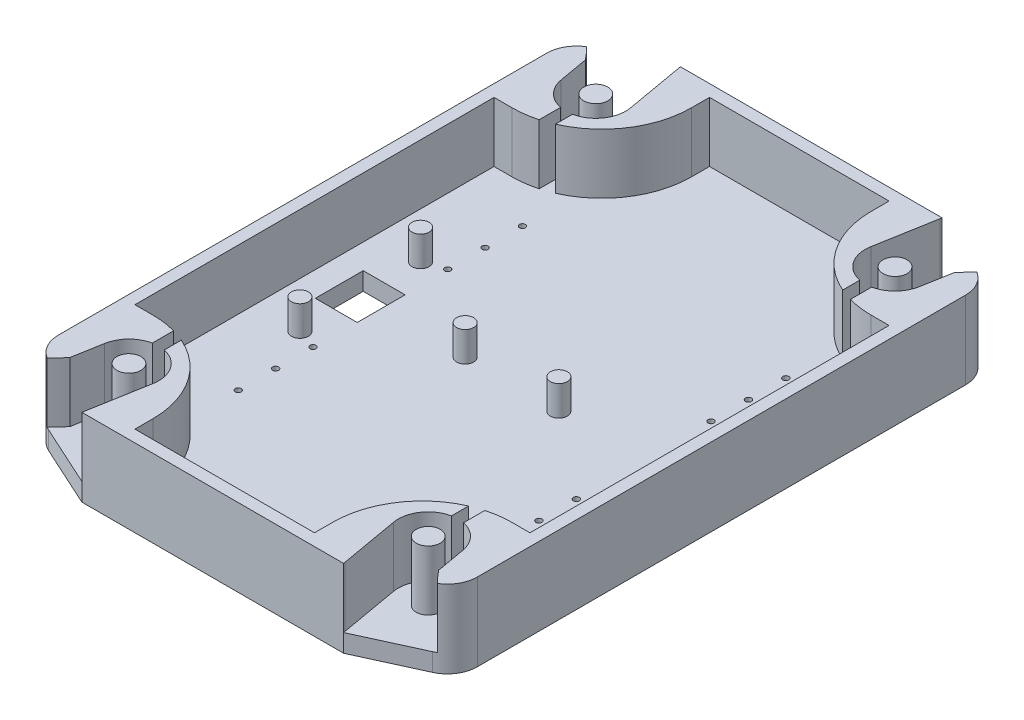
from build123d import *

# Parameters (mm, degrees)
CROQUIS2_W                = 70
CROQUIS2_H                = 3
SALIENTE_EXTRUIR1_DEPTH   = 100
CROQUIS3_W                = 20
CROQUIS3_H                = 20
SALIENTE_EXTRUIR2_DEPTH   = 10
CROQUIS4_W                = 30
CROQUIS4_H                = 10
CORTAR_EXTRUIR1_DEPTH     = 10
CROQUIS6_W                = 10
CROQUIS6_H                = 25
CORTAR_EXTRUIR6_DEPTH     = 1.5
CROQUIS7_R                = 1.425
SALIENTE_EXTRUIR3_DEPTH   = 5
CROQUIS9_R                = 1.425
SALIENTE_EXTRUIR4_DEPTH   = 5
CROQUIS11_W               = 7
CROQUIS11_H               = 8
CORTAR_EXTRUIR8_DEPTH     = 5
CROQUIS12_W               = 2
CROQUIS12_H               = 60
CROQUIS12_W_2             = 30
CROQUIS12_H_2             = 2
SALIENTE_EXTRUIR5_DEPTH   = 10
CROQUIS13_R               = 2
CORTAR_EXTRUIR9_DEPTH     = 10
CORTAR_EXTRUIR10_DEPTH    = 10
REDONDEO1_R               = 15
CORTAR_EXTRUIR11_DEPTH    = 107.418983405
REDONDEO4_R               = 5
CORTAR_EXTRUIR12_DEPTH    = 1.5
CROQUIS18_R               = 1
CORTAR_EXTRUIR13_DEPTH    = 1
SIMETR_A5_COPY_1_DEPTH    = 1.5
SIMETR_A5_COPY_2_SKETCH_R = 1
SIMETR_A5_COPY_2_DEPTH    = 1
CROQUIS19_W               = 2
CROQUIS19_H               = 9.548619871
CORTAR_EXTRUIR14_DEPTH    = 10
CROQUIS24_R               = 0.5
CORTAR_EXTRUIR18_DEPTH    = 10
CROQUIS25_R               = 0.5
CORTAR_EXTRUIR19_DEPTH    = 10
CROQUIS26_R               = 0.5
CORTAR_EXTRUIR20_DEPTH    = 10


with BuildPart() as part:
    # Croquis2 → Saliente-Extruir1 (new body)
    with BuildSketch(Plane.XY):
        Rectangle(CROQUIS2_W, CROQUIS2_H)
    extrude(amount=SALIENTE_EXTRUIR1_DEPTH)

    # Croquis3 → Saliente-Extruir2 (add)
    with BuildSketch(Plane(origin=(0, 1.5, 0), x_dir=(1, 0, 0), z_dir=(0, 1, 0))):
        with Locations((-25, -10)):
            Rectangle(CROQUIS3_W, CROQUIS3_H)
        with Locations((25, -10)):
            Rectangle(CROQUIS3_W, CROQUIS3_H)
        with Locations((25, -90)):
            Rectangle(CROQUIS3_W, CROQUIS3_H)
        with Locations((-25, -90)):
            Rectangle(CROQUIS3_W, CROQUIS3_H)
    extrude(amount=SALIENTE_EXTRUIR2_DEPTH)

    # Croquis4 → Cortar-Extruir1 (cut)
    with BuildSketch(Plane(origin=(0, 1.5, 0), x_dir=(1, 0, 0), z_dir=(0, 1, 0))):
        with Locations((0, -93)):
            Rectangle(CROQUIS4_W, CROQUIS4_H)
    extrude(amount=-CORTAR_EXTRUIR1_DEPTH, mode=Mode.SUBTRACT)

    # Croquis6 → Cortar-Extruir6 (cut)
    with BuildSketch(Plane.XZ.offset(1.5)):
        with Locations((-20, 67.5)):
            Rectangle(CROQUIS6_W, CROQUIS6_H)
        with Locations((-20, 32.5)):
            Rectangle(CROQUIS6_W, CROQUIS6_H)
        with Locations((20, 32.5)):
            Rectangle(CROQUIS6_W, CROQUIS6_H)
        with Locations((20, 67.5)):
            Rectangle(CROQUIS6_W, CROQUIS6_H)
    extrude(amount=-CORTAR_EXTRUIR6_DEPTH, mode=Mode.SUBTRACT)

    # Croquis7 → Saliente-Extruir3 (add)
    with BuildSketch(Plane(origin=(0, 1.5, 0), x_dir=(1, 0, 0), z_dir=(0, 1, 0))):
        with Locations(Location((-25.358591425, -60.075, 0), (0, 0, 90))):
            Circle(CROQUIS7_R)
        with Locations(Location((-25.358591425, -39.925, 0), (0, 0, 90))):
            Circle(CROQUIS7_R)
    extrude(amount=SALIENTE_EXTRUIR3_DEPTH)

    # Croquis9 → Saliente-Extruir4 (add)
    with BuildSketch(Plane(origin=(0, 1.5, 0), x_dir=(1, 0, 0), z_dir=(0, 1, 0))):
        with Locations(Location((-7.825, -50, 0), (0, 0, 90))):
            Circle(CROQUIS9_R)
        with Locations(Location((7.825, -50, 0), (0, 0, 90))):
            Circle(CROQUIS9_R)
    extrude(amount=SALIENTE_EXTRUIR4_DEPTH)

    # Croquis11 → Cortar-Extruir8 (cut)
    with BuildSketch(Plane(origin=(0, 1.5, 0), x_dir=(1, 0, 0), z_dir=(0, 1, 0))):
        with Locations((-25.358591425, -50)):
            Rectangle(CROQUIS11_W, CROQUIS11_H)
    extrude(amount=-CORTAR_EXTRUIR8_DEPTH, mode=Mode.SUBTRACT)

    # Croquis12 → Saliente-Extruir5 (add)
    with BuildSketch(Plane(origin=(0, 1.5, 0), x_dir=(1, 0, 0), z_dir=(0, 1, 0))):
        with Locations((-34, -50)):
            Rectangle(CROQUIS12_W, CROQUIS12_H)
        with Locations((0, -99)):
            Rectangle(CROQUIS12_W_2, CROQUIS12_H_2)
        with Locations((34, -50)):
            Rectangle(CROQUIS12_W, CROQUIS12_H)
        with Locations((0, -1)):
            Rectangle(CROQUIS12_W_2, CROQUIS12_H_2)
    extrude(amount=SALIENTE_EXTRUIR5_DEPTH)

    # Croquis13 → Cortar-Extruir9 (cut)
    # profile 1 of 2: a face of its own
    with BuildSketch(Plane(origin=(0, 11.5, 0), x_dir=(1, 0, 0), z_dir=(0, 1, 0))):
        with BuildLine():
            Line((-29.924038765, -11.868240888), (-31.660520542, -2.020163358))
            ThreePointArc((-31.660520542, -2.020163358), (-27.604722665, 3.772116295), (-21.812443012, -0.283681582))
            Line((-21.812443012, -0.283681582), (-20.075961235, -10.131759112))
            ThreePointArc((-20.075961235, -10.131759112), (-24.131759112, -15.924038765), (-29.924038765, -11.868240888))
        make_face()
        with Locations(Location((-25, -11, 0), (0, 0, 270))):
            Circle(CROQUIS13_R, mode=Mode.SUBTRACT)
    # profile 2 of 2: a face of its own
    with BuildSketch(Plane(origin=(0, 11.5, 0), x_dir=(1, 0, 0), z_dir=(0, 1, 0))):
        with BuildLine():
            Line((29.924038765, -11.868240888), (31.660520542, -2.020163358))
            ThreePointArc((31.660520542, -2.020163358), (27.604722665, 3.772116295), (21.812443012, -0.283681582))
            Line((21.812443012, -0.283681582), (20.075961235, -10.131759112))
            ThreePointArc((20.075961235, -10.131759112), (24.131759112, -15.924038765), (29.924038765, -11.868240888))
        make_face()
        with Locations(Location((25, -11, 0), (0, 0, 90))):
            Circle(CROQUIS13_R, mode=Mode.SUBTRACT)
    cortar_extruir9 = extrude(amount=-CORTAR_EXTRUIR9_DEPTH, mode=Mode.SUBTRACT)

    # Simetría1: Cortar-Extruir9 across plane
    add(cortar_extruir9.mirror(Plane(origin=(0, 0, 50), x_dir=(1, 0, 0), z_dir=(0, 0, -1))), mode=Mode.SUBTRACT)

    # Croquis14 → Cortar-Extruir10 (cut)
    with BuildSketch(Plane(origin=(0, 11.5, 0), x_dir=(1, 0, 0), z_dir=(0, 1, 0))):
        with BuildLine():
            Line((-30.792279653, -6.944202123), (-30.792279653, 3.632920573))
            Line((-30.792279653, 3.632920573), (-47.516838987, 3.632920573))
            Line((-47.516838987, 3.632920573), (-47.516838987, 0))
            add(Edge.make_bspline(
                [(-30.792279653, -6.944202123), (-37.68049077, 1.574687245), (-47.516838987, 0)],
                knots=[0, 0, 0, 1, 1, 1], degree=2))
        make_face()
        with BuildLine():
            Line((30.792279653, 3.632920573), (47.516838987, 3.632920573))
            Line((47.516838987, 3.632920573), (47.516838987, 0))
            add(Edge.make_bspline(
                [(30.792279653, -6.944202123), (37.68049077, 1.574687245), (47.516838987, 0)],
                knots=[0, 0, 0, 1, 1, 1], degree=2))
            Line((30.792279653, -6.944202123), (30.792279653, 3.632920573))
        make_face()
    cortar_extruir10 = extrude(amount=-CORTAR_EXTRUIR10_DEPTH, mode=Mode.SUBTRACT)

    # Simetría2: Cortar-Extruir10 across plane
    add(cortar_extruir10.mirror(Plane(origin=(0, 0, 50), x_dir=(1, 0, 0), z_dir=(0, 0, -1))), mode=Mode.SUBTRACT)

    # Redondeo1
    # the kernel refuses this fillet: 15 mm, written as the material it takes off along each edge
    with BuildSketch(Plane(origin=(-15, -36, 80), x_dir=(-1, 0, 0), z_dir=(0, 1, 0))) as redondeo1_piece_1_section:
        with BuildLine():
            CenterArc((REDONDEO1_R, REDONDEO1_R), REDONDEO1_R, 180, 90)
            Line((0, REDONDEO1_R), (0, 0))
            Line((0, 0), (REDONDEO1_R, 0))
        make_face()
    redondeo1_piece_1 = extrude(amount=85, mode=Mode.PRIVATE)
    redondeo1_piece_1 = split(redondeo1_piece_1, bisect_by=Plane(origin=(-15.514459499, -0.75, 88), z_dir=(0, 0, 1)), keep=Keep.TOP, mode=Mode.PRIVATE)
    add(redondeo1_piece_1, mode=Mode.SUBTRACT)
    with BuildSketch(Plane(origin=(-15, 1.5, 80), x_dir=(-1, 0, 0), z_dir=(0, 1, 0)), Plane(origin=(-15, 1.5, 20), x_dir=(0, 0, -1), z_dir=(0, 1, 0)), Plane(origin=(15, 1.5, 20), x_dir=(1, 0, 0), z_dir=(0, 1, 0)), Plane(origin=(15, 1.5, 80), x_dir=(0, 0, 1), z_dir=(0, 1, 0))) as redondeo1_piece_2:
        with BuildLine():
            CenterArc((REDONDEO1_R, REDONDEO1_R), REDONDEO1_R, 180, 90)
            Line((0, REDONDEO1_R), (0, 0))
            Line((0, 0), (REDONDEO1_R, 0))
        make_face()
    extrude(amount=47.5, mode=Mode.SUBTRACT)
    with BuildSketch(Plane(origin=(15, -36, 80), x_dir=(0, 0, 1), z_dir=(0, 1, 0))) as redondeo1_piece_3_section:
        with BuildLine():
            CenterArc((REDONDEO1_R, REDONDEO1_R), REDONDEO1_R, 180, 90)
            Line((0, REDONDEO1_R), (0, 0))
            Line((0, 0), (REDONDEO1_R, 0))
        make_face()
    redondeo1_piece_3 = extrude(amount=85, mode=Mode.PRIVATE)
    redondeo1_piece_3 = split(redondeo1_piece_3, bisect_by=Plane(origin=(15.514459499, -0.75, 88), z_dir=(0, 0, 1)), keep=Keep.TOP, mode=Mode.PRIVATE)
    add(redondeo1_piece_3, mode=Mode.SUBTRACT)

    # Croquis16 → Cortar-Extruir11 (cut, symmetric)
    with BuildSketch(Plane(origin=(0, 1.5, 0), x_dir=(1, 0, 0), z_dir=(0, 1, 0))):
        Polygon((-21.870983383, -100), (-35.000000004, -94), (-35, -100), align=None)
        Polygon((35.000000004, -94), (35, -100), (21.870983383, -100), align=None)
    cortar_extruir11 = extrude(amount=CORTAR_EXTRUIR11_DEPTH, both=True, mode=Mode.SUBTRACT)

    # Simetría3: Cortar-Extruir11 across plane
    add(cortar_extruir11.mirror(Plane(origin=(0, 0, 50), x_dir=(1, 0, 0), z_dir=(0, 0, -1))), mode=Mode.SUBTRACT)

    # Redondeo4
    redondeo4_edges = [part.edges().sort_by_distance(p)[0] for p in [
        (35.000000004, 5, 94),
        (-35.000000004, 5, 94),
        (35.000000004, 5, 6),
        (-35.000000004, 5, 6),
    ]]
    fillet(redondeo4_edges, radius=REDONDEO4_R)

    # Croquis17 → Cortar-Extruir12 (cut)
    with BuildSketch(Plane.XZ.offset(1.5)):
        with BuildLine():
            Line((-32.317047737, 87.192172163), (-24.609624551, 93.563641996))
            ThreePointArc((-24.609624551, 93.563641996), (-21.089901296, 93.229653658), (-21.423889634, 89.709930404))
            Line((-21.423889634, 89.709930404), (-29.13131282, 83.33846057))
            ThreePointArc((-29.13131282, 83.33846057), (-32.651036075, 83.672448908), (-32.317047737, 87.192172163))
        make_face()
    cortar_extruir12 = extrude(amount=-CORTAR_EXTRUIR12_DEPTH, mode=Mode.SUBTRACT)

    # Croquis18 → Cortar-Extruir13 (cut)
    with BuildSketch(Plane.XZ):
        with Locations(Location((-30.724180278, 85.265316367, 0), (0, 0, 270))):
            Circle(CROQUIS18_R)
        with Locations(Location((-23.016757093, 91.6367862, 0), (0, 0, 270))):
            Circle(CROQUIS18_R)
    cortar_extruir13 = extrude(amount=-CORTAR_EXTRUIR13_DEPTH, mode=Mode.SUBTRACT)

    # Simetría4: Cortar-Extruir12, Cortar-Extruir13 across plane
    add(cortar_extruir12.mirror(Plane(origin=(0, 0, 0), x_dir=(0, 0, 1), z_dir=(1, 0, 0))), mode=Mode.SUBTRACT)
    add(cortar_extruir13.mirror(Plane(origin=(0, 0, 0), x_dir=(0, 0, 1), z_dir=(1, 0, 0))), mode=Mode.SUBTRACT)

    # Simetría5: Cortar-Extruir12, Cortar-Extruir13 across plane
    add(cortar_extruir12.mirror(Plane(origin=(0, 0, 50), x_dir=(1, 0, 0), z_dir=(0, 0, -1))), mode=Mode.SUBTRACT)
    add(cortar_extruir13.mirror(Plane(origin=(0, 0, 50), x_dir=(1, 0, 0), z_dir=(0, 0, -1))), mode=Mode.SUBTRACT)

    # Simetría5 copy 1 sketch → Simetría5 copy 1 (cut)
    with BuildSketch(Plane(origin=(0, -1.5, 100), x_dir=(-1, 0, 0), z_dir=(0, -1, 0))):
        with BuildLine():
            Line((-32.317047737, 87.192172163), (-24.609624551, 93.563641996))
            ThreePointArc((-24.609624551, 93.563641996), (-21.089901296, 93.229653658), (-21.423889634, 89.709930404))
            Line((-21.423889634, 89.709930404), (-29.13131282, 83.33846057))
            ThreePointArc((-29.13131282, 83.33846057), (-32.651036075, 83.672448908), (-32.317047737, 87.192172163))
        make_face()
    extrude(amount=-SIMETR_A5_COPY_1_DEPTH, mode=Mode.SUBTRACT)

    # Simetría5 copy 2 sketch → Simetría5 copy 2 (cut)
    with BuildSketch(Plane(origin=(0, 0, 100), x_dir=(-1, 0, 0), z_dir=(0, -1, 0))):
        with Locations(Location((-30.724180278, 85.265316367, 0), (0, 0, 270))):
            Circle(SIMETR_A5_COPY_2_SKETCH_R)
        with Locations(Location((-23.016757093, 91.6367862, 0), (0, 0, 270))):
            Circle(SIMETR_A5_COPY_2_SKETCH_R)
    extrude(amount=-SIMETR_A5_COPY_2_DEPTH, mode=Mode.SUBTRACT)

    # Croquis19 → Cortar-Extruir14 (cut)
    with BuildSketch(Plane(origin=(0, 11.5, 0), x_dir=(1, 0, 0), z_dir=(0, 1, 0))):
        with Locations((-25, -18.136264595)):
            Rectangle(CROQUIS19_W, CROQUIS19_H)
        with Locations((25, -18.136264595)):
            Rectangle(CROQUIS19_W, CROQUIS19_H)
    cortar_extruir14 = extrude(amount=-CORTAR_EXTRUIR14_DEPTH, mode=Mode.SUBTRACT)

    # Simetría6: Cortar-Extruir14 across plane
    add(cortar_extruir14.mirror(Plane(origin=(0, 0, 50), x_dir=(1, 0, 0), z_dir=(0, 0, -1))), mode=Mode.SUBTRACT)

    # Croquis24 → Cortar-Extruir18 (cut)
    with BuildSketch(Plane.XZ):
        with Locations(Location((-22, 38.75, 0), (0, 0, 270))):
            Circle(CROQUIS24_R)
        with Locations(Location((-22, 32.5, 0), (0, 0, 270))):
            Circle(CROQUIS24_R)
        with Locations(Location((-22, 26.25, 0), (0, 0, 270))):
            Circle(CROQUIS24_R)
    extrude(amount=-CORTAR_EXTRUIR18_DEPTH, mode=Mode.SUBTRACT)

    # Croquis25 → Cortar-Extruir19 (cut)
    with BuildSketch(Plane.XZ):
        with Locations(Location((-22, 73.75, 0), (0, 0, 270))):
            Circle(CROQUIS25_R)
        with Locations(Location((-22, 67.5, 0), (0, 0, 270))):
            Circle(CROQUIS25_R)
        with Locations(Location((-22, 61.25, 0), (0, 0, 270))):
            Circle(CROQUIS25_R)
    extrude(amount=-CORTAR_EXTRUIR19_DEPTH, mode=Mode.SUBTRACT)

    # Croquis26 → Cortar-Extruir20 (cut)
    with BuildSketch(Plane.XZ):
        with Locations(Location((22, 73.75, 0), (0, 0, 270))):
            Circle(CROQUIS26_R)
        with Locations(Location((22, 67.5, 0), (0, 0, 270))):
            Circle(CROQUIS26_R)
        with Locations(Location((22, 61.25, 0), (0, 0, 270))):
            Circle(CROQUIS26_R)
        with Locations(Location((22, 38.75, 0), (0, 0, 270))):
            Circle(CROQUIS26_R)
        with Locations(Location((22, 32.5, 0), (0, 0, 270))):
            Circle(CROQUIS26_R)
        with Locations(Location((22, 26.25, 0), (0, 0, 270))):
            Circle(CROQUIS26_R)
    extrude(amount=-CORTAR_EXTRUIR20_DEPTH, mode=Mode.SUBTRACT)


solid = part.part
